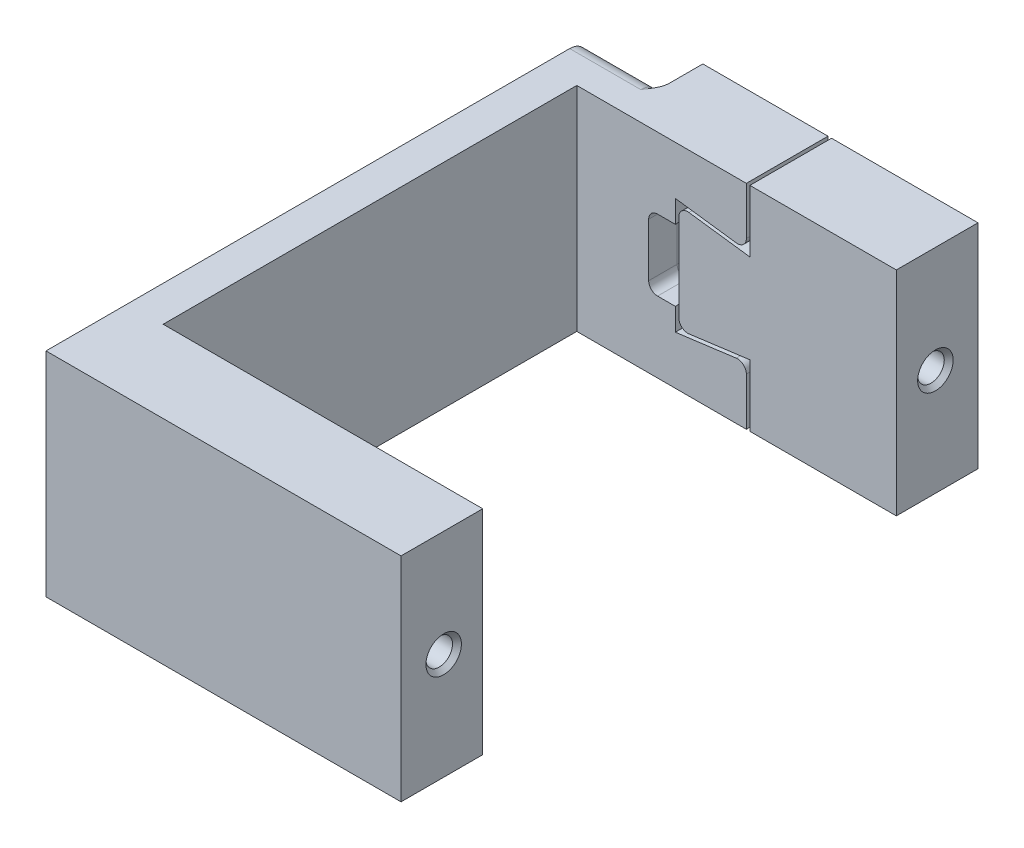
from build123d import *

# Parameters (mm, degrees)
BOSS_EXTRUDE1_DEPTH = 6
SKETCH4_R           = 0.75
CUT_EXTRUDE3_DEPTH  = 8
CHAMFER1_SIZE       = 0.25
CUT_EXTRUDE1_REACH  = 40.63
SKETCH2_W           = 1.5
SKETCH2_H           = 4
SKETCH5_W           = 6.05
SKETCH5_H           = 4
CUT_EXTRUDE5_DEPTH  = 2
SKETCH6_W           = 4.5
SKETCH6_H           = 2
CUT_EXTRUDE6_DEPTH  = 29.426440157
FILLET7_R           = 1
CUT_EXTRUDE2_REACH  = 40.63
FILLET9_R           = 0.5
FILLET3_R           = 0.5


with BuildPart() as part:
    # Sketch1 → Boss-Extrude1 (new, symmetric)
    with BuildSketch(Plane(origin=(0, 0, 0), x_dir=(1, 0, 0), z_dir=(0, 1, 0))):
        Polygon((0, 16.25), (0, 11.65), (-18, 11.65), (-18, -11.65), (0, -11.65), (0, -16.25), (-20, -16.25), (-20, 16.25), align=None)
    extrude(amount=BOSS_EXTRUDE1_DEPTH, both=True)

    # Sketch4 → Cut-Extrude3 (cut)
    with BuildSketch(Plane(origin=(0, 0, 0), x_dir=(0, 0, -1), z_dir=(1, 0, 0))):
        with Locations((13.85, 0)):
            Circle(SKETCH4_R)
        with Locations((-13.85, 0)):
            Circle(SKETCH4_R)
    extrude(amount=-CUT_EXTRUDE3_DEPTH, mode=Mode.SUBTRACT)

    # Chamfer1
    chamfer1_edges = [part.edges().sort_by_distance(p)[0] for p in [
        (0, 0, -13.1),
        (0, 0, 14.6),
    ]]
    chamfer(chamfer1_edges, length=CHAMFER1_SIZE)

    # Sketch2 → Cut-Extrude1 (cut, up to next)
    with BuildSketch(Plane(origin=(0, 0, -16.25), x_dir=(-1, 0, 0), z_dir=(0, 0, -1)), mode=Mode.PRIVATE) as cut_extrude1_sk1:
        with Locations((13.2, 0)):
            Rectangle(SKETCH2_W, SKETCH2_H)
    cut_extrude1_tool1 = extrude(cut_extrude1_sk1.sketch, amount=-CUT_EXTRUDE1_REACH, mode=Mode.PRIVATE) & part.part
    add(cut_extrude1_tool1.solids().sort_by_distance((-13.2, 0, -16.25))[0], mode=Mode.SUBTRACT)

    # Sketch5 → Cut-Extrude5 (cut)
    with BuildSketch(Plane(origin=(0, 0, -16.25), x_dir=(-1, 0, 0), z_dir=(0, 0, -1))):
        with Locations((16.975, 0)):
            Rectangle(SKETCH5_W, SKETCH5_H)
    extrude(amount=-CUT_EXTRUDE5_DEPTH, mode=Mode.SUBTRACT)

    # Sketch6 → Cut-Extrude6 (cut, through all)
    with BuildSketch(Plane.XZ.offset(6)):
        with Locations((-17.75, -15.25)):
            Rectangle(SKETCH6_W, SKETCH6_H)
    extrude(amount=-CUT_EXTRUDE6_DEPTH, mode=Mode.SUBTRACT)

    # Fillet7
    fillet7_edges = [part.edges().sort_by_distance(p)[0] for p in [
        (-13.95, 0, -14.25),
        (-17.75, 6, -14.25),
        (-17.75, -6, -14.25),
    ]]
    fillet(fillet7_edges, radius=FILLET7_R)

    # Sketch3 → Cut-Extrude2 (cut, up to next)
    with BuildSketch(Plane(origin=(0, 0, -16.25), x_dir=(-1, 0, 0), z_dir=(0, 0, -1)), mode=Mode.PRIVATE) as cut_extrude2_sk1:
        Polygon((8.45, -6), (8.45, -2.736695005), (12.45, -3.263304995), (12.45, 3.263304995), (8.45, 2.736695005), (8.45, 6), (8.25, 6), (8.25, 2.508638713), (12.25, 3.035248704), (12.25, -3.035248704), (8.25, -2.508638713), (8.25, -6), align=None)
    cut_extrude2_tool1 = extrude(cut_extrude2_sk1.sketch, amount=-CUT_EXTRUDE2_REACH, mode=Mode.PRIVATE) & part.part
    add(cut_extrude2_tool1.solids().sort_by_distance((-8.322862, -4.368348, -16.25))[0], mode=Mode.SUBTRACT)


with BuildPart() as cut_extrude2_piece_1:
    # of the separate pieces the step leaves, piece 1, a body of its own (cut_extrude2_pieces)
    add(part.part.solids().sort_by_distance((-13.95, -2, -13.25))[0])

    # Fillet9
    # the kernel refuses this fillet: 0.5 mm, written as the material it takes off along each edge
    with BuildSketch(Plane(origin=(-15.5, -2, -17.5), x_dir=(1, 0, 0), z_dir=(0, 0, 1)), Plane(origin=(-15.5, 2, -14.25), x_dir=(1, 0, 0), z_dir=(0, 0, -1))) as fillet9_piece_1:
        with BuildLine():
            CenterArc((FILLET9_R, -FILLET9_R), FILLET9_R, 90, 90)
            Line((0, -FILLET9_R), (0, 0))
            Line((0, 0), (FILLET9_R, 0))
        make_face()
    extrude(amount=3.25, mode=Mode.SUBTRACT)
    with BuildSketch(Plane(origin=(-8.45, 2.736695005, -17.675351823), x_dir=(-0.9914448613738108, 0.1305261922200488, 0), z_dir=(0, 0, 1)), Plane(origin=(-8.45, -2.736695005, -17.675351823), x_dir=(0, -1, 0), z_dir=(0, 0, 1))) as fillet9_piece_2:
        with BuildLine():
            CenterArc((FILLET9_R * 1.14028145817, -FILLET9_R), FILLET9_R, 90, 97.5)
            Line((FILLET9_R * 0.148836596794, -FILLET9_R * 1.13052619222), (0, 0))
            Line((0, 0), (FILLET9_R * 1.14028145817, 0))
        make_face()
    extrude(amount=7.450703645, mode=Mode.SUBTRACT)
    # the kernel refuses this fillet: 0.5 mm, written as the material it adds along each edge
    with BuildSketch(Plane(origin=(-13.95, -2, -13.25), x_dir=(0, 1, 0), z_dir=(0, 0, 1))) as fillet9_2_piece_1:
        with BuildLine():
            CenterArc((FILLET9_R, -FILLET9_R), FILLET9_R, 90, 90)
            Line((0, -FILLET9_R), (0, 0))
            Line((0, 0), (FILLET9_R, 0))
        make_face()
    extrude(amount=1.6)
    with BuildSketch(Plane(origin=(-14.95, -2, -13.25), x_dir=(1, 0, 0), z_dir=(0, 0, 1))) as fillet9_2_piece_2:
        with BuildLine():
            CenterArc((1 + FILLET9_R, FILLET9_R), FILLET9_R, 180, 90)
            Line((1, FILLET9_R), (1, 0))
            Line((1, 0), (1 + FILLET9_R, 0))
        make_face()
    revolve(axis=Axis((-14.95, -2, -13.25), (0, 1, 0)), revolution_arc=90)
    with BuildSketch(Plane(origin=(-13.95, 2, -13.25), x_dir=(0, -1, 0), z_dir=(0, 0, 1))) as fillet9_2_piece_3:
        with BuildLine():
            CenterArc((FILLET9_R, FILLET9_R), FILLET9_R, 180, 90)
            Line((0, FILLET9_R), (0, 0))
            Line((0, 0), (FILLET9_R, 0))
        make_face()
    extrude(amount=1.6)
    with BuildSketch(Plane(origin=(-14.95, 2, -13.25), x_dir=(1, 0, 0), z_dir=(0, 0, 1))) as fillet9_2_piece_4:
        with BuildLine():
            CenterArc((1 + FILLET9_R, -FILLET9_R), FILLET9_R, 90, 90)
            Line((1 + FILLET9_R, 0), (1, 0))
            Line((1, 0), (1, -FILLET9_R))
        make_face()
    revolve(axis=Axis((-14.95, 2, -13.25), (0, 1, 0)), revolution_arc=90)
    with BuildSketch(Plane(origin=(-15.5, 2.5, -14.25), x_dir=(-1, 0, 0), z_dir=(0, 1, 0)), Plane(origin=(-15.5, -5, -14.25), x_dir=(-1, 0, 0), z_dir=(0, 1, 0))) as fillet9_2_piece_5:
        with BuildLine():
            CenterArc((FILLET9_R, -FILLET9_R), FILLET9_R, 90, 90)
            Line((0, -FILLET9_R), (0, 0))
            Line((0, 0), (FILLET9_R, 0))
        make_face()
    extrude(amount=2.5)
    with BuildSketch(Plane(origin=(-14.95, 2, -14.25), x_dir=(0, 0, -1), z_dir=(-1, 0, 0)), Plane(origin=(-15, -2, -14.25), x_dir=(0, 0, -1), z_dir=(1, 0, 0))) as fillet9_2_piece_6:
        with BuildLine():
            CenterArc((FILLET9_R, FILLET9_R), FILLET9_R, 180, 90)
            Line((0, FILLET9_R), (0, 0))
            Line((0, 0), (FILLET9_R, 0))
        make_face()
    extrude(amount=0.05)
    with BuildSketch(Plane(origin=(-15.5, 5, -13.25), x_dir=(0, 0, -1), z_dir=(0, -1, 0))) as fillet9_2_piece_7_section:
        with BuildLine():
            CenterArc((1 + FILLET9_R, -FILLET9_R), FILLET9_R, 90, 90)
            Line((1 + FILLET9_R, 0), (1, 0))
            Line((1, 0), (1, -FILLET9_R))
        make_face()
    fillet9_2_piece_7 = revolve(axis=Axis((-15.5, 5, -13.25), (1, 0, 0)), revolution_arc=161.648494619, mode=Mode.PRIVATE)
    fillet9_2_piece_7 = split(fillet9_2_piece_7, bisect_by=Plane(origin=(-15.636075231, 6, -13.981098286), z_dir=(0, -1, 0)), keep=Keep.TOP, mode=Mode.PRIVATE)
    add(fillet9_2_piece_7)
    with BuildSketch(Plane(origin=(-15.5, -5, -13.25), x_dir=(0, 0, -1), z_dir=(0, 1, 0))) as fillet9_2_piece_8_section:
        with BuildLine():
            CenterArc((1 + FILLET9_R, FILLET9_R), FILLET9_R, 180, 90)
            Line((1 + FILLET9_R, 0), (1, 0))
            Line((1, 0), (1, FILLET9_R))
        make_face()
    fillet9_2_piece_8 = revolve(axis=Axis((-15.5, -5, -13.25), (-1, 0, 0)), revolution_arc=161.648494619, mode=Mode.PRIVATE)
    fillet9_2_piece_8 = split(fillet9_2_piece_8, bisect_by=Plane(origin=(-15.636075231, -6, -13.981098286), z_dir=(0, 1, 0)), keep=Keep.TOP, mode=Mode.PRIVATE)
    add(fillet9_2_piece_8)
    with BuildSketch(Plane(origin=(-15, -2.5, -14.25), x_dir=(0, 1, 0), z_dir=(1, 0, 0))) as fillet9_2_piece_9:
        with BuildLine():
            CenterArc((0.5 + FILLET9_R, -FILLET9_R), FILLET9_R, 90, 90)
            Line((0.5, -FILLET9_R), (0.5, 0))
            Line((0.5, 0), (0.5 + FILLET9_R, 0))
        make_face()
    revolve(axis=Axis((-15, -2.5, -14.25), (0, 0, 1)), revolution_arc=90)
    with BuildSketch(Plane(origin=(-15, 2.5, -14.25), x_dir=(0, -1, 0), z_dir=(1, 0, 0))) as fillet9_2_piece_10:
        with BuildLine():
            CenterArc((0.5 + FILLET9_R, FILLET9_R), FILLET9_R, 180, 90)
            Line((0.5, FILLET9_R), (0.5, 0))
            Line((0.5, 0), (0.5 + FILLET9_R, 0))
        make_face()
    revolve(axis=Axis((-15, 2.5, -14.25), (0, 0, -1)), revolution_arc=90)

    # Sketch9 → Revolve2 (revolve)
    with BuildSketch(Plane(origin=(0, 0, 0), x_dir=(1, 0, 0), z_dir=(0, 1, 0))):
        Polygon((-20, 5.25), (-23.5, 5.25), (-23.5, 6.7), (-20.5, 6.7), (-20.5, 7.25), (-20, 7.25), align=None)
    revolve(axis=Axis((0, 0, -5.25), (-1, 0, 0)))


with BuildPart() as cut_extrude2_piece_2:
    # of the separate pieces the step leaves, piece 2, a body of its own (cut_extrude2_pieces)
    add(part.part.solids().sort_by_distance((0, 6, -11.65))[0])

    # Fillet3
    fillet3_edges = [cut_extrude2_piece_2.edges().sort_by_distance(p)[0] for p in [
        (-12.25, 3.035248704, -13.95),
        (-12.25, -3.035248704, -13.95),
    ]]
    fillet(fillet3_edges, radius=FILLET3_R)


solid = Compound([cut_extrude2_piece_1.part, cut_extrude2_piece_2.part])
